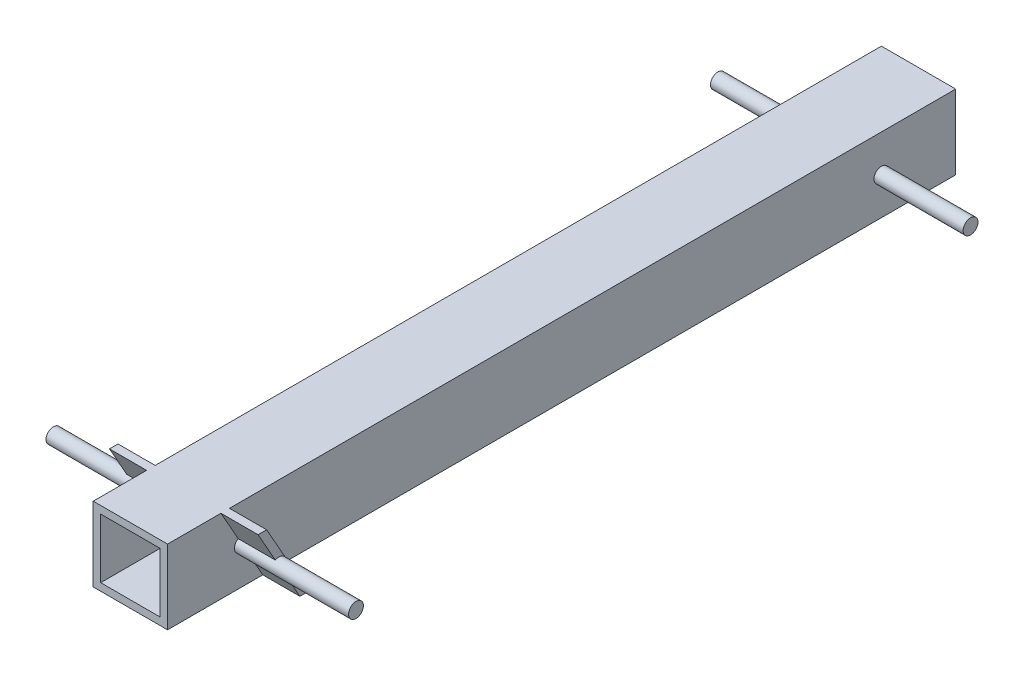
from build123d import *

# Parameters (mm, degrees)
SKETCH_1_W           = 10
SKETCH_1_H           = 10
SKETCH_1_W_2         = 8
SKETCH_1_H_2         = 8
EXTRUDE_1_DEPTH      = 106.066
SKETCH_2_R           = 1
CUT_EXTRUDE_1_DEPTH  = 10
EXTRUDE_3_DEPTH      = 12
EXTRUDE_3_DEPTH_BACK = 22
SKETCH_5_R           = 1
EXTRUDE_7_DEPTH      = 15.36
EXTRUDE_7_DEPTH_BACK = 25.36
SKETCH_9_R           = 1
EXTRUDE_8_DEPTH      = 5
EXTRUDE_8_DEPTH_BACK = 15


with BuildPart() as part:
    # 草图1 → 凸台-拉伸1 (new body)
    with BuildSketch(Plane.XY):
        with Locations((5, 5)):
            Rectangle(SKETCH_1_W, SKETCH_1_H)
        with Locations((5, 5)):
            Rectangle(SKETCH_1_W_2, SKETCH_1_H_2, mode=Mode.SUBTRACT)
    extrude(amount=EXTRUDE_1_DEPTH)

    # 草图2 → 切除-拉伸1 (cut)
    with BuildSketch(Plane(origin=(10, 0, 0), x_dir=(0, 0, -1), z_dir=(1, 0, 0))):
        with Locations((-10, 5)):
            Circle(SKETCH_2_R)
    extrude(amount=-CUT_EXTRUDE_1_DEPTH, mode=Mode.SUBTRACT)

    # 草图5 → 凸台-拉伸3 (add, two sides: drawn at the far end of the back side and taken through both)
    with BuildSketch(Plane(origin=(10, 0, 0), x_dir=(0, 0, -1), z_dir=(1, 0, 0)).offset(-EXTRUDE_3_DEPTH_BACK)):
        with Locations((-10, 5)):
            Circle(SKETCH_5_R)
    extrude(amount=EXTRUDE_3_DEPTH + EXTRUDE_3_DEPTH_BACK)

    # 草图9 → 凸台-拉伸7 (add, two sides: drawn at the far end of the back side and taken through both)
    with BuildSketch(Plane(origin=(10, 0, 0), x_dir=(0, 0, -1), z_dir=(1, 0, 0)).offset(-EXTRUDE_7_DEPTH_BACK)):
        with Locations((-96.066, 5)):
            Circle(SKETCH_9_R)
    extrude(amount=EXTRUDE_7_DEPTH + EXTRUDE_7_DEPTH_BACK)

    # 草图10 → 凸台-拉伸8 (add, two sides: drawn at the far end of the back side and taken through both)
    with BuildSketch(Plane(origin=(10, 0, 0), x_dir=(0, 0, -1), z_dir=(1, 0, 0)).offset(-EXTRUDE_8_DEPTH_BACK)):
        Polygon((-93.251, 0), (-92.103407302, 0), (-97.733407302, 10), (-98.881, 10), align=None)
    extrude(amount=EXTRUDE_8_DEPTH + EXTRUDE_8_DEPTH_BACK)


solid = part.part
